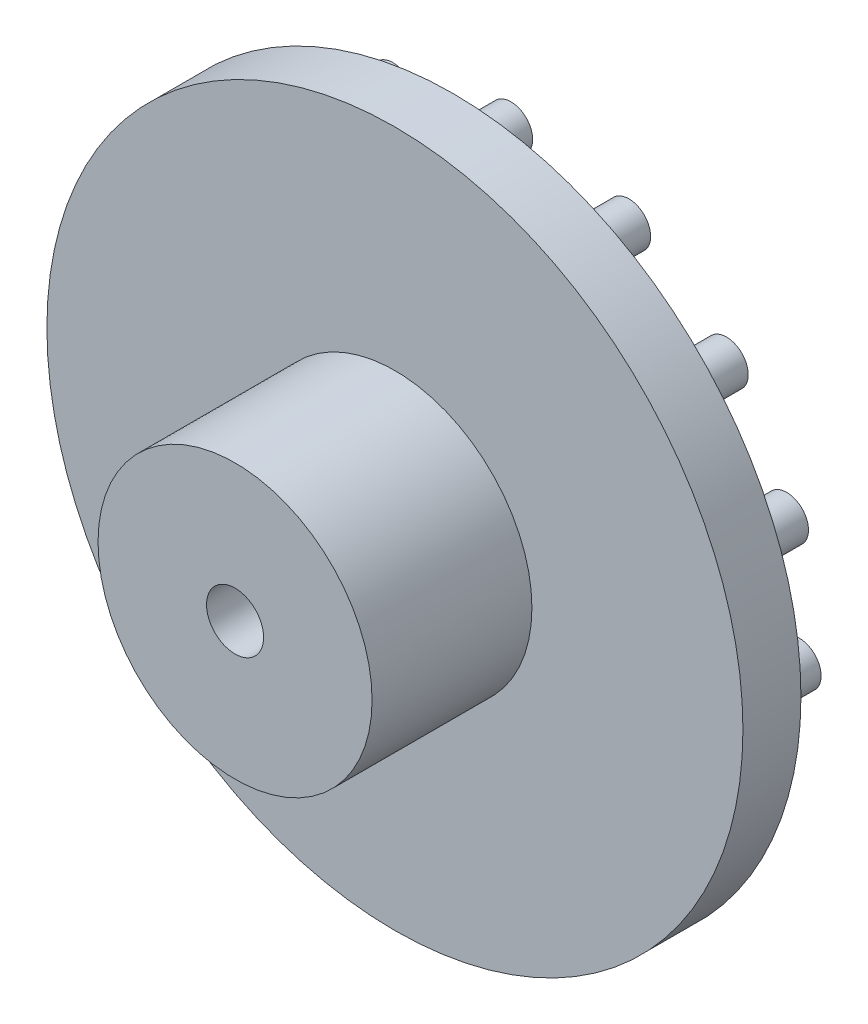
from build123d import *

# Parameters (mm, degrees)
SKETCH1_R                 = 15.24
SKETCH1_R_2               = 4.55
BOSS_EXTRUDE1_DEPTH       = 2.54
SKETCH2_R                 = 6
BOSS_EXTRUDE2_DEPTH       = 7
SKETCH5_R                 = 0.9525
BOSS_EXTRUDE5_DEPTH       = 2.54
M3X0_5_TAPPED_HOLE1_D     = 2.5
M3X0_5_TAPPED_HOLE1_DEPTH = 7.5
M3X0_5_TAPPED_HOLE1_TIP   = 0.751075774


with BuildPart() as part:
    # Sketch1 → Boss-Extrude1 (new body)
    with BuildSketch(Plane.XY):
        Circle(SKETCH1_R)
        Circle(SKETCH1_R_2, mode=Mode.SUBTRACT)
    extrude(amount=BOSS_EXTRUDE1_DEPTH)

    # Sketch2 → Boss-Extrude2 (add)
    with BuildSketch(Plane.XY.offset(2.54)):
        Circle(SKETCH2_R)
    extrude(amount=BOSS_EXTRUDE2_DEPTH)

    # Sketch5 → Boss-Extrude5 (add)
    with BuildSketch(Plane(origin=(0, 0, 0), x_dir=(-1, 0, 0), z_dir=(0, 0, -1))):
        with Locations((0, 12.7)):
            Circle(SKETCH5_R)
        with Locations((5.165555367, 11.602027312)):
            Circle(SKETCH5_R)
        with Locations((9.437939284, 8.497958701)):
            Circle(SKETCH5_R)
        with Locations((12.078417757, 3.924515829)):
            Circle(SKETCH5_R)
        with Locations((12.630428071, -1.327511483)):
            Circle(SKETCH5_R)
        with Locations((10.998522628, -6.35)):
            Circle(SKETCH5_R)
        with Locations((7.464872704, -10.274515829)):
            Circle(SKETCH5_R)
        with Locations((2.640478473, -12.422474529)):
            Circle(SKETCH5_R)
        with Locations((-2.640478473, -12.422474529)):
            Circle(SKETCH5_R)
        with Locations((-7.464872704, -10.274515829)):
            Circle(SKETCH5_R)
        with Locations((-10.998522628, -6.35)):
            Circle(SKETCH5_R)
        with Locations((-12.630428071, -1.327511483)):
            Circle(SKETCH5_R)
        with Locations((-12.078417757, 3.924515829)):
            Circle(SKETCH5_R)
        with Locations((-9.437939284, 8.497958701)):
            Circle(SKETCH5_R)
        with Locations((-5.165555367, 11.602027312)):
            Circle(SKETCH5_R)
    extrude(amount=BOSS_EXTRUDE5_DEPTH)

    # M3x0.5 Tapped Hole1
    with Locations(Plane.XY.offset(9.54)):
        with Locations((0, 0)):
            Hole(M3X0_5_TAPPED_HOLE1_D / 2, depth=M3X0_5_TAPPED_HOLE1_DEPTH)
            with Locations((0, 0, -(M3X0_5_TAPPED_HOLE1_DEPTH + M3X0_5_TAPPED_HOLE1_TIP / 2))):  # 118° drill point
                Cone(0, M3X0_5_TAPPED_HOLE1_D / 2, M3X0_5_TAPPED_HOLE1_TIP, mode=Mode.SUBTRACT)


solid = part.part
